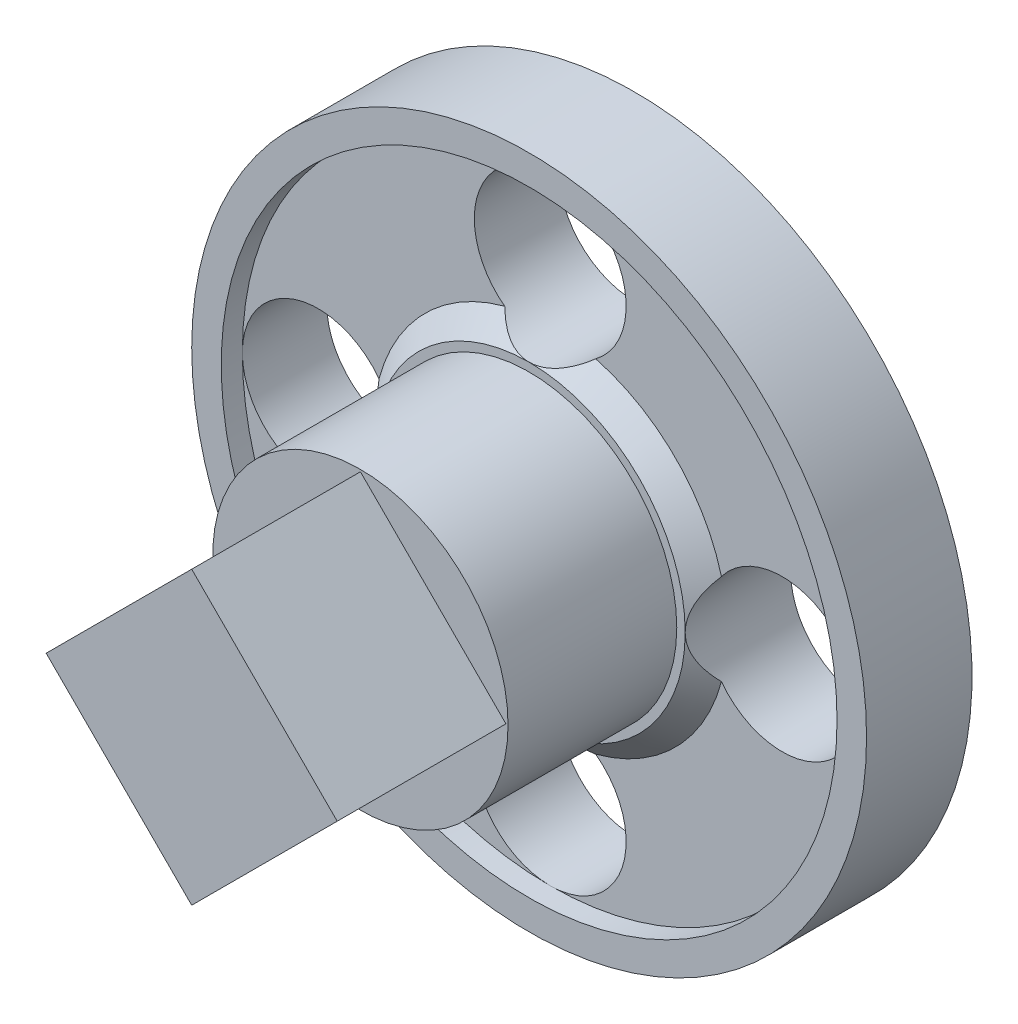
from build123d import *

# Parameters (mm, degrees)
SKETCH_1_R           = 9
SKETCH_1_R_2         = 1.8
EXTRUDE_1_DEPTH      = 3
SKETCH_2_R           = 2.5
EXTRUDE_2_DEPTH      = 5
SKETCH_3_R           = 3
EXTRUDE_3_DEPTH      = 1
EXTRUDE_4_DEPTH      = 1
EXTRUDE_4_DEPTH_BACK = 1
SKETCH_4_R           = 0.75
SKETCH_5_R           = 11.774758228
CUT_EXTRUDE_1_DEPTH  = 10
EXTRUDE_5_DEPTH      = 2
CUT_EXTRUDE_2_DEPTH  = 2
SKETCH_8_R           = 14.855083979
SKETCH_8_R_2         = 8
CUT_EXTRUDE_3_DEPTH  = 10
CUT_EXTRUDE_START    = -0.5
SKETCH_9_R           = 4.256493188
SKETCH_9_R_2         = 2.5
CUT_EXTRUDE_4_DEPTH  = 0.5
SKETCH_10_R          = 3.45
EXTRUDE_6_DEPTH      = 3.5
SKETCH_11_R          = 3.7
EXTRUDE_7_DEPTH      = 3.5
CHAMFER_1_SIZE       = 0.5
EXTRUDE_8_DEPTH      = 4
SKETCH_13_R          = 4.2
SKETCH_13_R_2        = 3.45
CUT_EXTRUDE_5_DEPTH  = 3
SKETCH_14_R          = 6
SKETCH_14_R_2        = 3.7
CUT_EXTRUDE_6_DEPTH  = 0.5
CHAMFER_2_SIZE       = 0.5
CHAMFER_3_SIZE       = 0.5
SKETCH_15_R          = 3.5
EXTRUDE_9_DEPTH      = 4
SKETCH_16_R          = 7.3
SKETCH_16_R_2        = 4.506279258
CUT_EXTRUDE_7_DEPTH  = 3
SKETCH_19_R          = 10.067308749
CUT_EXTRUDE_9_DEPTH  = 0.5


with BuildPart() as part:
    # 草图1 → 凸台-拉伸1 (new body)
    with BuildSketch(Plane.XY):
        Circle(SKETCH_1_R)
        with Locations((0, 5.5)):
            Circle(SKETCH_1_R_2, mode=Mode.SUBTRACT)
        with Locations((5.5, 0)):
            Circle(SKETCH_1_R_2, mode=Mode.SUBTRACT)
        with Locations((0, -5.5)):
            Circle(SKETCH_1_R_2, mode=Mode.SUBTRACT)
        with Locations((-5.5, 0)):
            Circle(SKETCH_1_R_2, mode=Mode.SUBTRACT)
    extrude(amount=EXTRUDE_1_DEPTH)

    # 草图2 → 凸台-拉伸2 (add)
    with BuildSketch(Plane.XY.offset(3)):
        Circle(SKETCH_2_R)
    extrude(amount=EXTRUDE_2_DEPTH)

    # 草图3 → 凸台-拉伸3 (add)
    with BuildSketch(Plane.XY.offset(3)):
        Circle(SKETCH_3_R)
    extrude(amount=EXTRUDE_3_DEPTH)

    # 草图4 → 凸台-拉伸4 (add, two sides: drawn at the far end of the back side and taken through both)
    # profile 1 of 2: a face of its own
    with BuildSketch(Plane.XY.offset(8).offset(-EXTRUDE_4_DEPTH_BACK)):
        with BuildLine():
            Line((2.485541606, 0.268482638), (1.988740974, 4.867732145))
            ThreePointArc((1.988740974, 4.867732145), (-0.00103483, 6.652941663), (-1.988404355, 4.865053763))
            Line((-1.988404355, 4.865053763), (-1.989024096, 4.859160292))
            Line((-1.989024096, 4.859160292), (-2.445314485, 0.520035641))
            ThreePointArc((-2.445314485, 0.520035641), (0.12737458, 2.496753035), (2.485541606, 0.268482638))
        make_face()
        with Locations((0.000312053, 4.652946506)):
            Circle(SKETCH_4_R, mode=Mode.SUBTRACT)
    # profile 2 of 2: a face of its own
    with BuildSketch(Plane.XY.offset(8).offset(-EXTRUDE_4_DEPTH_BACK)):
        with BuildLine():
            ThreePointArc((2.5, 0), (2.496382785, 0.134435832), (2.485541606, 0.268482638))
            ThreePointArc((2.485541606, 0.268482638), (0.12737458, 2.496753035), (-2.445314485, 0.520035641))
            Line((-2.445314485, 0.520035641), (-2.5, 0))
            ThreePointArc((-2.5, 0), (0, -2.5), (2.5, 0))
        make_face()
    extrude(amount=EXTRUDE_4_DEPTH + EXTRUDE_4_DEPTH_BACK)

    # 草图5 → 切除-拉伸1 (cut)
    with BuildSketch(Plane(origin=(0, 0, 7), x_dir=(-1, 0, 0), z_dir=(0, 0, -1))):
        Circle(SKETCH_5_R)
        Polygon((0, 2.481609408), (2.5, 0), (0, -2.5), (-2.5, 0), align=None, mode=Mode.SUBTRACT)
    extrude(amount=-CUT_EXTRUDE_1_DEPTH, mode=Mode.SUBTRACT)

    # 草图6 → 凸台-拉伸5 (add)
    with BuildSketch(Plane.XY.offset(9)):
        Polygon((0, 2.5), (-2.5, 0), (0, -2.5), (2.5, 0), align=None)
    extrude(amount=EXTRUDE_5_DEPTH)

    # 草图7 → 切除-拉伸2 (cut)
    with BuildSketch(Plane(origin=(0, 0, 9), x_dir=(-1, 0, 0), z_dir=(0, 0, -1))):
        Polygon((0, 2.481609408), (-2.5, 0), (-8.257651415, 6.64470805), (8.324868768, 1.809009791), (0.901487765, -7.246606168), (2.5, 0), align=None)
    extrude(amount=-CUT_EXTRUDE_2_DEPTH, mode=Mode.SUBTRACT)

    # 草图8 → 切除-拉伸3 (cut)
    with BuildSketch(Plane(origin=(0, 0, 0), x_dir=(-1, 0, 0), z_dir=(0, 0, -1))):
        with Locations((-0.238627472, 0)):
            Circle(SKETCH_8_R)
        Circle(SKETCH_8_R_2, mode=Mode.SUBTRACT)
    extrude(amount=-CUT_EXTRUDE_3_DEPTH, mode=Mode.SUBTRACT)

    # 草图9 → 切除-拉伸4 (cut)
    with BuildSketch(Plane.XY.offset(4).offset(CUT_EXTRUDE_START)):
        with Locations((0, 0.120232911)):
            Circle(SKETCH_9_R)
        Circle(SKETCH_9_R_2, mode=Mode.SUBTRACT)
    extrude(amount=CUT_EXTRUDE_4_DEPTH, mode=Mode.SUBTRACT)

    # 草图10 → 凸台-拉伸6 (add)
    with BuildSketch(Plane.XY.offset(3.5)):
        Circle(SKETCH_10_R)
    extrude(amount=EXTRUDE_6_DEPTH)

    # 草图11 → 凸台-拉伸7 (add)
    with BuildSketch(Plane(origin=(0, 0, 3.5), x_dir=(-1, 0, 0), z_dir=(0, 0, -1))):
        with Locations(Location((0, 0, 0), (0, 0, 180.000240938))):
            Circle(SKETCH_11_R)
    extrude(amount=EXTRUDE_7_DEPTH)

    # 倒角1
    # the kernel refuses this chamfer: 0.5 mm, written as the material it adds along each edge
    with BuildSketch(Plane(origin=(0, 0, 3), x_dir=(2.429298144255796e-07, -0.9999999999999705, 0), z_dir=(-0.9999999999999705, -2.429298144255796e-07, 0))) as chamfer_1_piece_1_section:
        Polygon((3.7 + CHAMFER_1_SIZE, 0), (3.7, CHAMFER_1_SIZE), (3.7, 0), align=None)
    chamfer_1_piece_1 = revolve(axis=Axis((0, 0, 3), (0, 0, 1)), revolution_arc=89.999745143, mode=Mode.PRIVATE)
    chamfer_1_piece_1 = chamfer_1_piece_1 - Plane(origin=(5.5, 0, 3.243994097), x_dir=(1, 0, 0), z_dir=(0, 0, -1)) * Cylinder(1.8, 17, mode=Mode.PRIVATE)
    chamfer_1_piece_1 = chamfer_1_piece_1 - Plane(origin=(0, -5.5, 3.243994097), x_dir=(1, 0, 0), z_dir=(0, 0, -1)) * Cylinder(1.8, 17, mode=Mode.PRIVATE)
    add(chamfer_1_piece_1)
    with BuildSketch(Plane(origin=(0, 0, 3), x_dir=(0.9999999999911583, -4.205161392743551e-06, 0), z_dir=(-4.205161392743551e-06, -0.9999999999911583, 0))) as chamfer_1_piece_2_section:
        Polygon((3.7 + CHAMFER_1_SIZE, 0), (3.7, CHAMFER_1_SIZE), (3.7, 0), align=None)
    chamfer_1_piece_2 = revolve(axis=Axis((0, 0, 3), (0, 0, 1)), revolution_arc=90.000240938, mode=Mode.PRIVATE)
    chamfer_1_piece_2 = chamfer_1_piece_2 - Plane(origin=(0, 5.5, 3.243994362), x_dir=(1, 0, 0), z_dir=(0, 0, -1)) * Cylinder(1.8, 17, mode=Mode.PRIVATE)
    chamfer_1_piece_2 = chamfer_1_piece_2 - Plane(origin=(5.5, 0, 3.243994362), x_dir=(1, 0, 0), z_dir=(0, 0, -1)) * Cylinder(1.8, 17, mode=Mode.PRIVATE)
    add(chamfer_1_piece_2)
    with BuildSketch(Plane(origin=(0, 0, 3), x_dir=(-1, 0, 0), z_dir=(0, 1, 0))) as chamfer_1_piece_3_section:
        Polygon((3.7 + CHAMFER_1_SIZE, 0), (3.7, CHAMFER_1_SIZE), (3.7, 0), align=None)
    chamfer_1_piece_3 = revolve(axis=Axis((0, 0, 3), (0, 0, 1)), revolution_arc=90.000013919, mode=Mode.PRIVATE)
    chamfer_1_piece_3 = chamfer_1_piece_3 - Plane(origin=(-5.5, 0, 3.24399412), x_dir=(1, 0, 0), z_dir=(0, 0, -1)) * Cylinder(1.8, 17, mode=Mode.PRIVATE)
    chamfer_1_piece_3 = chamfer_1_piece_3 - Plane(origin=(0, -5.5, 3.24399412), x_dir=(1, 0, 0), z_dir=(0, 0, -1)) * Cylinder(1.8, 17, mode=Mode.PRIVATE)
    add(chamfer_1_piece_3)
    with BuildSketch(Plane(origin=(0, 0, 3), x_dir=(0, 1, 0), z_dir=(1, 0, 0))) as chamfer_1_piece_4_section:
        Polygon((3.7 + CHAMFER_1_SIZE, 0), (3.7, CHAMFER_1_SIZE), (3.7, 0), align=None)
    chamfer_1_piece_4 = revolve(axis=Axis((0, 0, 3), (0, 0, 1)), revolution_arc=90, mode=Mode.PRIVATE)
    chamfer_1_piece_4 = chamfer_1_piece_4 - Plane(origin=(0, 5.5, 3.243994109), x_dir=(1, 0, 0), z_dir=(0, 0, -1)) * Cylinder(1.8, 17, mode=Mode.PRIVATE)
    chamfer_1_piece_4 = chamfer_1_piece_4 - Plane(origin=(-5.5, 0, 3.243994109), x_dir=(1, 0, 0), z_dir=(0, 0, -1)) * Cylinder(1.8, 17, mode=Mode.PRIVATE)
    add(chamfer_1_piece_4)

    # 草图12 → 凸台-拉伸8 (add)
    with BuildSketch(Plane.XY.offset(7)):
        Polygon((0, 3.45), (-3.45, 0), (0, -3.45), (3.45, 0), align=None)
    extrude(amount=EXTRUDE_8_DEPTH)

    # 草图13 → 切除-拉伸5 (cut)
    with BuildSketch(Plane.XY.offset(3)):
        Circle(SKETCH_13_R)
        Circle(SKETCH_13_R_2, mode=Mode.SUBTRACT)
    extrude(amount=CUT_EXTRUDE_5_DEPTH, mode=Mode.SUBTRACT)

    # 草图14 → 切除-拉伸6 (cut)
    with BuildSketch(Plane.XY.offset(3)):
        Circle(SKETCH_14_R)
        Circle(SKETCH_14_R_2, mode=Mode.SUBTRACT)
    extrude(amount=-CUT_EXTRUDE_6_DEPTH, mode=Mode.SUBTRACT)

    # 倒角2
    # the kernel refuses this chamfer: 0.5 mm, written as the material it adds along each edge
    with BuildSketch(Plane(origin=(0, 0, 2.5), x_dir=(2.6572576900546526e-07, 0.9999999999999647, 0), z_dir=(0.9999999999999647, -2.6572576900546526e-07, 0))) as chamfer_2_piece_1_section:
        Polygon((3.7, CHAMFER_2_SIZE), (3.7 + CHAMFER_2_SIZE, 0), (3.7, 0), align=None)
    chamfer_2_piece_1 = revolve(axis=Axis((0, 0, 2.5), (0, 0, 1)), revolution_arc=90.000015225, mode=Mode.PRIVATE)
    chamfer_2_piece_1 = chamfer_2_piece_1 - Plane(origin=(-5.5, 0, 2.743994122), x_dir=(1, 0, 0), z_dir=(0, 0, -1)) * Cylinder(1.8, 17, mode=Mode.PRIVATE)
    chamfer_2_piece_1 = chamfer_2_piece_1 - Plane(origin=(0, 5.5, 2.743994122), x_dir=(1, 0, 0), z_dir=(0, 0, -1)) * Cylinder(1.8, 17, mode=Mode.PRIVATE)
    add(chamfer_2_piece_1)
    with BuildSketch(Plane(origin=(0, 0, 2.5), x_dir=(1, 0, 0), z_dir=(0, -1, 0))) as chamfer_2_piece_2_section:
        Polygon((3.7, CHAMFER_2_SIZE), (3.7 + CHAMFER_2_SIZE, 0), (3.7, 0), align=None)
    chamfer_2_piece_2 = revolve(axis=Axis((0, 0, 2.5), (0, 0, 1)), revolution_arc=89.999984775, mode=Mode.PRIVATE)
    chamfer_2_piece_2 = chamfer_2_piece_2 - Plane(origin=(0, 5.5, 2.743994101), x_dir=(1, 0, 0), z_dir=(0, 0, -1)) * Cylinder(1.8, 17, mode=Mode.PRIVATE)
    chamfer_2_piece_2 = chamfer_2_piece_2 - Plane(origin=(5.5, 0, 2.743994101), x_dir=(1, 0, 0), z_dir=(0, 0, -1)) * Cylinder(1.8, 17, mode=Mode.PRIVATE)
    add(chamfer_2_piece_2)
    with BuildSketch(Plane(origin=(0, 0, 2.5), x_dir=(-1, 0, 0), z_dir=(0, 1, 0))) as chamfer_2_piece_3_section:
        Polygon((3.7 + CHAMFER_2_SIZE, 0), (3.7, CHAMFER_2_SIZE), (3.7, 0), align=None)
    chamfer_2_piece_3 = revolve(axis=Axis((0, 0, 2.5), (0, 0, 1)), revolution_arc=90.000015225, mode=Mode.PRIVATE)
    chamfer_2_piece_3 = chamfer_2_piece_3 - Plane(origin=(0, -5.5, 2.743994115), x_dir=(1, 0, 0), z_dir=(0, 0, -1)) * Cylinder(1.8, 17, mode=Mode.PRIVATE)
    chamfer_2_piece_3 = chamfer_2_piece_3 - Plane(origin=(-5.5, 0, 2.743994115), x_dir=(1, 0, 0), z_dir=(0, 0, -1)) * Cylinder(1.8, 17, mode=Mode.PRIVATE)
    add(chamfer_2_piece_3)
    with BuildSketch(Plane(origin=(0, 0, 2.5), x_dir=(2.657257683164467e-07, -0.9999999999999647, 0), z_dir=(-0.9999999999999647, -2.657257683164467e-07, 0))) as chamfer_2_piece_4_section:
        Polygon((3.7, CHAMFER_2_SIZE), (3.7 + CHAMFER_2_SIZE, 0), (3.7, 0), align=None)
    chamfer_2_piece_4 = revolve(axis=Axis((0, 0, 2.5), (0, 0, 1)), revolution_arc=89.999984775, mode=Mode.PRIVATE)
    chamfer_2_piece_4 = chamfer_2_piece_4 - Plane(origin=(0, -5.5, 2.743994101), x_dir=(1, 0, 0), z_dir=(0, 0, -1)) * Cylinder(1.8, 17, mode=Mode.PRIVATE)
    chamfer_2_piece_4 = chamfer_2_piece_4 - Plane(origin=(5.5, 0, 2.743994101), x_dir=(1, 0, 0), z_dir=(0, 0, -1)) * Cylinder(1.8, 17, mode=Mode.PRIVATE)
    add(chamfer_2_piece_4)

    # 倒角3
    # the kernel refuses this chamfer: 0.5 mm, written as the material it adds along each edge
    with BuildSketch(Plane(origin=(0, 0, 2.5), x_dir=(0.08770420194381934, -0.9961465619884445, 0), z_dir=(-0.9961465619884445, -0.08770420194381934, 0))) as chamfer_3_piece_1_section:
        Polygon((6 - CHAMFER_3_SIZE, 0), (6, CHAMFER_3_SIZE), (6, 0), align=None)
    chamfer_3_piece_1 = revolve(axis=Axis((0, 0, 2.5), (0, 0, 1)), revolution_arc=79.936909611, mode=Mode.PRIVATE)
    chamfer_3_piece_1 = chamfer_3_piece_1 - Plane(origin=(0, -5.5, 2.736482642), x_dir=(1, 0, 0), z_dir=(0, 0, -1)) * Cylinder(1.8, 25, mode=Mode.PRIVATE)
    chamfer_3_piece_1 = chamfer_3_piece_1 - Plane(origin=(5.5, 0, 2.736482642), x_dir=(1, 0, 0), z_dir=(0, 0, -1)) * Cylinder(1.8, 25, mode=Mode.PRIVATE)
    chamfer_3_piece_1 = split(chamfer_3_piece_1, bisect_by=Plane(origin=(4.065422208, -4.065422207, 3), z_dir=(0, 0, -1)), keep=Keep.TOP, mode=Mode.PRIVATE)
    add(chamfer_3_piece_1)
    with BuildSketch(Plane(origin=(0, 0, 2.5), x_dir=(-0.9961465619884445, -0.08770420194381941, 0), z_dir=(-0.08770420194381941, 0.9961465619884445, 0))) as chamfer_3_piece_2_section:
        Polygon((6 - CHAMFER_3_SIZE, 0), (6, CHAMFER_3_SIZE), (6, 0), align=None)
    chamfer_3_piece_2 = revolve(axis=Axis((0, 0, 2.5), (0, 0, 1)), revolution_arc=79.936909611, mode=Mode.PRIVATE)
    chamfer_3_piece_2 = chamfer_3_piece_2 - Plane(origin=(0, -5.5, 2.736482642), x_dir=(1, 0, 0), z_dir=(0, 0, -1)) * Cylinder(1.8, 25, mode=Mode.PRIVATE)
    chamfer_3_piece_2 = chamfer_3_piece_2 - Plane(origin=(-5.5, 0, 2.736482642), x_dir=(1, 0, 0), z_dir=(0, 0, -1)) * Cylinder(1.8, 25, mode=Mode.PRIVATE)
    chamfer_3_piece_2 = split(chamfer_3_piece_2, bisect_by=Plane(origin=(-4.065422207, -4.065422207, 3), z_dir=(0, 0, -1)), keep=Keep.TOP, mode=Mode.PRIVATE)
    add(chamfer_3_piece_2)
    with BuildSketch(Plane(origin=(0, 0, 2.5), x_dir=(0.9961465619884445, 0.08770420194381914, 0), z_dir=(0.08770420194381914, -0.9961465619884445, 0))) as chamfer_3_piece_3_section:
        Polygon((6, CHAMFER_3_SIZE), (6 - CHAMFER_3_SIZE, 0), (6, 0), align=None)
    chamfer_3_piece_3 = revolve(axis=Axis((0, 0, 2.5), (0, 0, 1)), revolution_arc=79.936909611, mode=Mode.PRIVATE)
    chamfer_3_piece_3 = chamfer_3_piece_3 - Plane(origin=(5.5, 0, 2.736482642), x_dir=(1, 0, 0), z_dir=(0, 0, -1)) * Cylinder(1.8, 24, mode=Mode.PRIVATE)
    chamfer_3_piece_3 = split(chamfer_3_piece_3, bisect_by=Plane(origin=(4.065422208, 4.065422207, 3), z_dir=(0, 0, -1)), keep=Keep.TOP, mode=Mode.PRIVATE)
    chamfer_3_piece_3 = chamfer_3_piece_3 - Plane(origin=(0, 5.5, 2.736482642), x_dir=(1, 0, 0), z_dir=(0, 0, -1)) * Cylinder(1.8, 24, mode=Mode.PRIVATE)
    add(chamfer_3_piece_3)
    with BuildSketch(Plane(origin=(0, 0, 2.5), x_dir=(-0.08770420194381902, 0.9961465619884445, 0), z_dir=(0.9961465619884445, 0.08770420194381902, 0))) as chamfer_3_piece_4_section:
        Polygon((6 - CHAMFER_3_SIZE, 0), (6, CHAMFER_3_SIZE), (6, 0), align=None)
    chamfer_3_piece_4 = revolve(axis=Axis((0, 0, 2.5), (0, 0, 1)), revolution_arc=79.936909611, mode=Mode.PRIVATE)
    chamfer_3_piece_4 = split(chamfer_3_piece_4, bisect_by=Plane(origin=(-4.065422207, 4.065422207, 3), z_dir=(0, 0, -1)), keep=Keep.TOP, mode=Mode.PRIVATE)
    chamfer_3_piece_4 = chamfer_3_piece_4 - Plane(origin=(0, 5.5, 2.736482642), x_dir=(1, 0, 0), z_dir=(0, 0, -1)) * Cylinder(1.8, 25, mode=Mode.PRIVATE)
    chamfer_3_piece_4 = chamfer_3_piece_4 - Plane(origin=(-5.5, 0, 2.736482642), x_dir=(1, 0, 0), z_dir=(0, 0, -1)) * Cylinder(1.8, 25, mode=Mode.PRIVATE)
    add(chamfer_3_piece_4)

    # 草图15 → 凸台-拉伸9 (add)
    with BuildSketch(Plane.XY.offset(3)):
        Circle(SKETCH_15_R)
    extrude(amount=EXTRUDE_9_DEPTH)

    # 草图16 → 切除-拉伸7 (cut)
    with BuildSketch(Plane.XY.offset(2.5)):
        Circle(SKETCH_16_R)
        with Locations((0.154292063, 0)):
            Circle(SKETCH_16_R_2, mode=Mode.SUBTRACT)
    extrude(amount=CUT_EXTRUDE_7_DEPTH, mode=Mode.SUBTRACT)

    # 草图19 → 切除-拉伸9 (cut)
    with BuildSketch(Plane(origin=(0, 0, 0), x_dir=(-1, 0, 0), z_dir=(0, 0, -1))):
        Circle(SKETCH_19_R)
    extrude(amount=-CUT_EXTRUDE_9_DEPTH, mode=Mode.SUBTRACT)


solid = part.part
